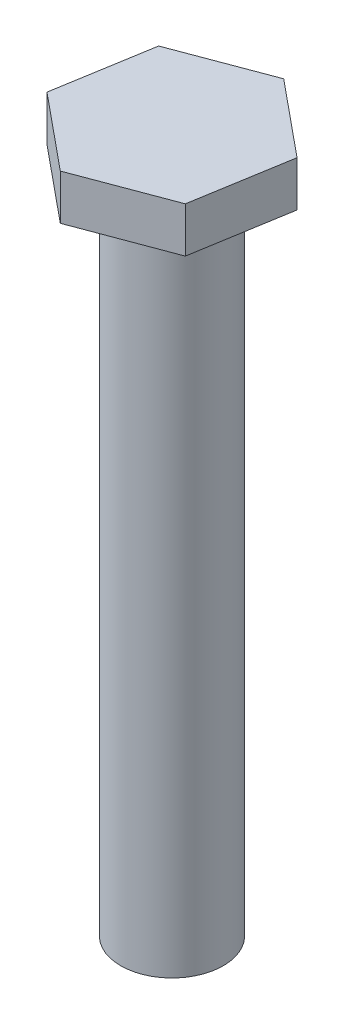
from build123d import *

# Parameters (mm, degrees)
SKETCH1_R   = 7.9375
SHAFT_DEPTH = 101.6
HEAD_DEPTH  = 7


with BuildPart() as part:
    # Sketch1 → Shaft (new body)
    with BuildSketch(Plane(origin=(0, 0, 0), x_dir=(1, 0, 0), z_dir=(0, 1, 0))):
        Circle(SKETCH1_R)
    extrude(amount=-SHAFT_DEPTH)

    # Sketch2 → Head (add)
    with BuildSketch(Plane(origin=(0, 0, 0), x_dir=(1, 0, 0), z_dir=(0, 1, 0))):
        Polygon((11.595031913, -9.533549616), (14.053812112, 5.274817386), (2.458780199, 14.808367002), (-11.595031913, 9.533549616), (-14.053812112, -5.274817386), (-2.458780199, -14.808367002), align=None)
    extrude(amount=HEAD_DEPTH)


solid = part.part
